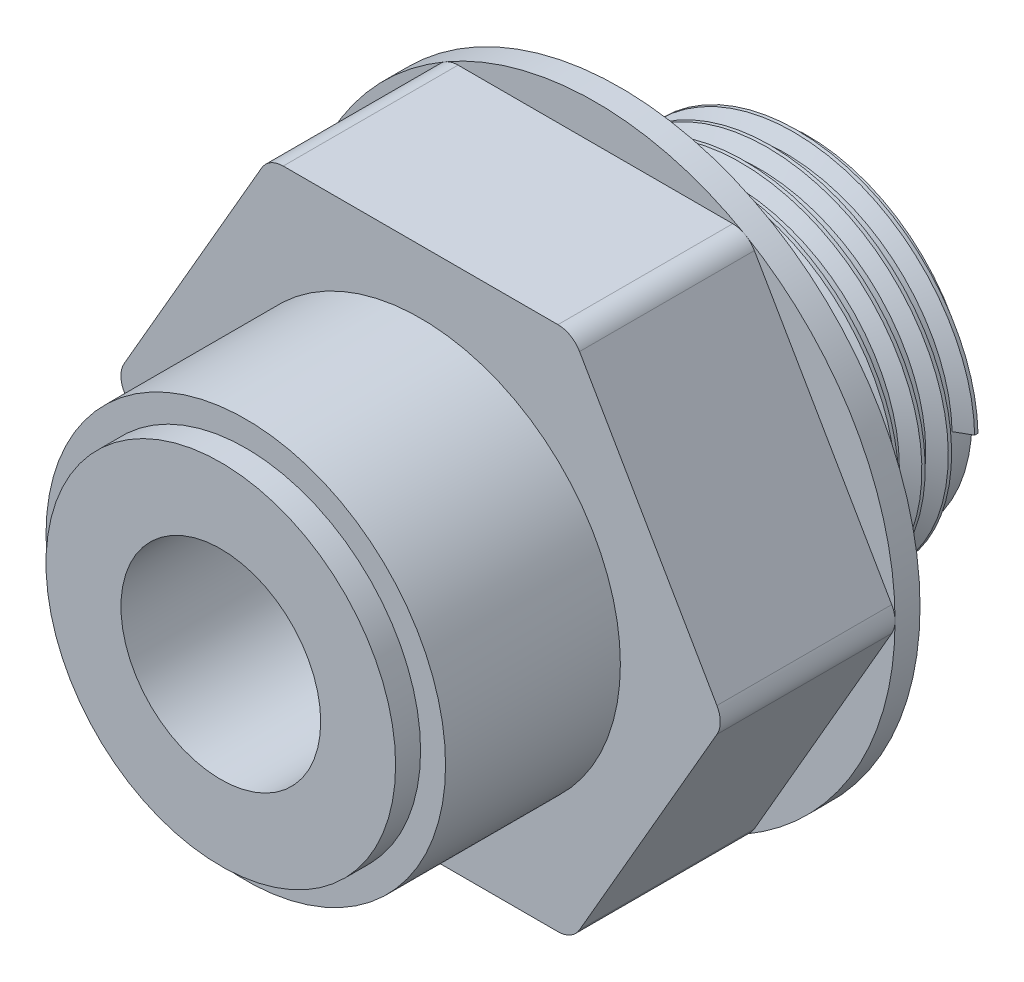
from build123d import *

# Parameters (mm, degrees)
THREAD1_PITCH      = 1.058333333
SKETCH6_OUTSIDE_W  = 34.256
SKETCH6_OUTSIDE_H  = 34.256
SKETCH6_OUTSIDE_R  = 7
CUT_EXTRUDE1_DEPTH = 1
SKETCH8_OUTSIDE_W  = 34.256
SKETCH8_OUTSIDE_H  = 34.256
CUT_EXTRUDE3_DEPTH = 7
SKETCH9_R          = 4
CUT_EXTRUDE4_DEPTH = 16


with BuildPart() as part:
    # Sketch2 → Revolve1 (revolve)
    with BuildSketch(Plane(origin=(0, 0, 0), x_dir=(0, 0, -1), z_dir=(1, 0, 0)), mode=Mode.PRIVATE) as revolve1_sk:
        Polygon((0, 3.25), (23.5, 3.25), (23.5, 6.5785), (16, 6.5785), (16, 12), (8, 12), (8, 8), (0, 8), align=None)
    revolve(revolve1_sk.sketch.rotate(Axis((0, 0, 17.665917422), (0, 0, -1)), 90), axis=Axis((0, 0, 17.665917422), (0, 0, -1)))

    # Thread1: the profile of Thread Profile1 profile screwed along a right-hand helix of 7.086614 turns, 8 arcs to a turn; built about Z, then put on its axis
    thread1_z = Axis((0, 0, 0), (0, 0, 1))
    thread1_corners = [(6.5782, 0, -0.000173205), (7.151339718, 0, 0.330729165), (7.151339718, 0, 0.463020832), (6.5782, 0, 0.793923202)]
    with BuildLine(mode=Mode.PRIVATE) as thread1_profile:
        Line(thread1_corners[0], thread1_corners[1])
        Line(thread1_corners[1], thread1_corners[2])
        Line(thread1_corners[2], thread1_corners[3])
        Line(thread1_corners[3], thread1_corners[0])
    thread1_cap = Face(thread1_profile.wire())
    thread1_turn_angles = [0, 22.5, 45, 67.5, 90, 112.5, 135, 157.5, 180, 202.5, 225, 247.5, 270, 292.5, 315, 337.5, 360]
    thread1_turn_weights = [1, 0.9238795325112867, 1, 0.9238795325112867, 1, 0.9238795325112867, 1, 0.9238795325112867, 1, 0.9238795325112867, 1, 0.9238795325112867, 1, 0.9238795325112867, 1, 0.9238795325112867, 1]
    thread1_turn_rails = [Edge.make_bspline([Vector(p[0], p[1], 0).rotate(thread1_z, thread1_turn_angles[k]) / thread1_turn_weights[k] + Vector(0, 0, p[2] + THREAD1_PITCH * thread1_turn_angles[k] / 360) for k in range(17)], [0, 0, 0, 1, 1, 2, 2, 3, 3, 4, 4, 5, 5, 6, 6, 7, 7, 8, 8, 8], 2, thread1_turn_weights) for p in thread1_corners]
    thread1_turn_sides = [Face.make_surface_from_curves(thread1_turn_rails[p[0]], thread1_turn_rails[p[1]]) for p in [(0, 1), (1, 2), (2, 3), (3, 0)]]
    thread1_last_angles = [2520, 2535.590551181, 2551.181102362]
    thread1_last_weights = [1, 0.9632069020746588, 1]
    thread1_last_rails = [Edge.make_bspline([Vector(p[0], p[1], 0).rotate(thread1_z, thread1_last_angles[k]) / thread1_last_weights[k] + Vector(0, 0, p[2] + THREAD1_PITCH * thread1_last_angles[k] / 360) for k in range(3)], [0, 0, 0, 1, 1, 1], 2, thread1_last_weights) for p in thread1_corners]
    thread1_last_sides = [Face.make_surface_from_curves(thread1_last_rails[p[0]], thread1_last_rails[p[1]]) for p in [(0, 1), (1, 2), (2, 3), (3, 0)]]
    thread1 = Plane(origin=(0, 0, -23.5), x_dir=(1, 0, 0), z_dir=(0, 0, 1)) * Solid(Shell([*[p.moved(Location((0, 0, THREAD1_PITCH * i))) for i in range(7) for p in thread1_turn_sides], *thread1_last_sides, thread1_cap, thread1_cap.rotate(thread1_z, 2551.181102362).moved(Location((0, 0, THREAD1_PITCH * 2551.181102362 / 360)))]))
    add(thread1)

    # Sketch6 outside → Cut-Extrude1 (cut)
    with BuildSketch(Plane.XY):
        Rectangle(SKETCH6_OUTSIDE_W, SKETCH6_OUTSIDE_H)
        Circle(SKETCH6_OUTSIDE_R, mode=Mode.SUBTRACT)
    extrude(amount=-CUT_EXTRUDE1_DEPTH, mode=Mode.SUBTRACT)

    # Sketch8 outside → Cut-Extrude3 (cut)
    with BuildSketch(Plane.XY.offset(-8)):
        Rectangle(SKETCH8_OUTSIDE_W, SKETCH8_OUTSIDE_H)
        with BuildLine():
            Line((-5.5, 10.526279442), (5.5, 10.526279442))
            ThreePointArc((5.5, 10.526279442), (6, 10.392304845), (6.366025404, 10.026279442))
            Line((6.366025404, 10.026279442), (11.866025404, 0.5))
            ThreePointArc((11.866025404, 0.5), (12, 0), (11.866025404, -0.5))
            Line((11.866025404, -0.5), (6.366025404, -10.026279442))
            ThreePointArc((6.366025404, -10.026279442), (6, -10.392304845), (5.5, -10.526279442))
            Line((5.5, -10.526279442), (-5.5, -10.526279442))
            ThreePointArc((-5.5, -10.526279442), (-6, -10.392304845), (-6.366025404, -10.026279442))
            Line((-6.366025404, -10.026279442), (-11.866025404, -0.5))
            ThreePointArc((-11.866025404, -0.5), (-12, 0), (-11.866025404, 0.5))
            Line((-11.866025404, 0.5), (-6.366025404, 10.026279442))
            ThreePointArc((-6.366025404, 10.026279442), (-6, 10.392304845), (-5.5, 10.526279442))
        make_face(mode=Mode.SUBTRACT)
    extrude(amount=-CUT_EXTRUDE3_DEPTH, mode=Mode.SUBTRACT)

    # Sketch9 → Cut-Extrude4 (cut)
    with BuildSketch(Plane.XY):
        Circle(SKETCH9_R)
    extrude(amount=-CUT_EXTRUDE4_DEPTH, mode=Mode.SUBTRACT)


solid = part.part
